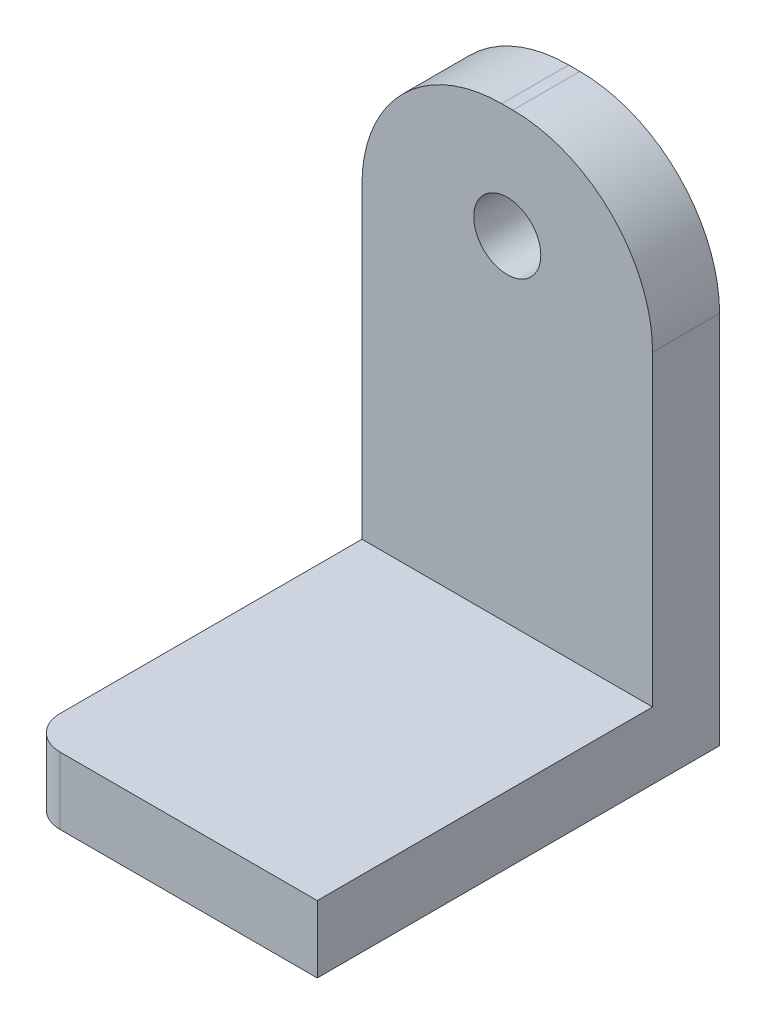
from build123d import *

# Parameters (mm, degrees)
BOSS_EXTRUDE1_DEPTH = 6
SKETCH2_W           = 26
SKETCH2_H           = 6
BOSS_EXTRUDE2_DEPTH = 40
FILLET1_R           = 12.5
SKETCH3_R           = 3
CUT_EXTRUDE1_DEPTH  = 74.228954843


with BuildPart() as part:
    # Sketch1 → Boss-Extrude1 (new body)
    with BuildSketch(Plane(origin=(0, -44, 0), x_dir=(1, 0, 0), z_dir=(0, 1, 0))):
        with BuildLine():
            Line((50.264100782, -8), (50.264100782, 28))
            Line((50.264100782, 28), (27.264100782, 28))
            ThreePointArc((27.264100782, 28), (25.142780438, 27.121320344), (24.264100782, 25))
            Line((24.264100782, 25), (24.264100782, -5))
            ThreePointArc((24.264100782, -5), (25.142780438, -7.121320344), (27.264100782, -8))
            Line((27.264100782, -8), (50.264100782, -8))
        make_face()
    extrude(amount=BOSS_EXTRUDE1_DEPTH)

    # Sketch2 → Boss-Extrude2 (add)
    with BuildSketch(Plane(origin=(0, -38, 0), x_dir=(1, 0, 0), z_dir=(0, 1, 0))):
        with Locations((37.264100782, 25)):
            Rectangle(SKETCH2_W, SKETCH2_H)
    extrude(amount=BOSS_EXTRUDE2_DEPTH)

    # Fillet1
    fillet1_edges = [part.edges().sort_by_distance(p)[0] for p in [
        (24.264100782, 2, -25),
        (50.264100782, 2, -25),
    ]]
    fillet(fillet1_edges, radius=FILLET1_R)

    # Sketch3 → Cut-Extrude1 (cut, through all)
    with BuildSketch(Plane.XY.offset(-22)):
        with Locations((37.264100782, -8)):
            Circle(SKETCH3_R)
    extrude(amount=-CUT_EXTRUDE1_DEPTH, mode=Mode.SUBTRACT)


solid = part.part
